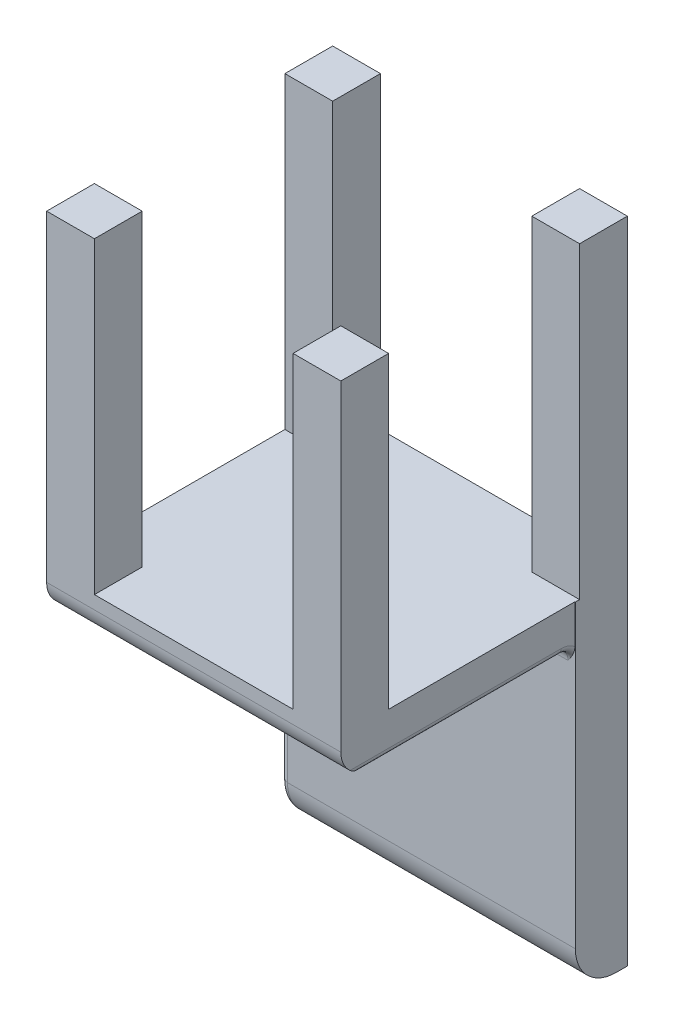
from build123d import *

# Parameters (mm, degrees)
BASE_EXTRUDE_DEPTH  = 76.2
BOSS_EXTRUDE2_DEPTH = 59.427356
SKETCH4_W           = 70
SKETCH4_H           = 70
BOSS_EXTRUDE3_DEPTH = 451.60000000000053
FILLET1_START       = -36.936387435
FILLET1_DEPTH       = 431.8
FILLET1_2_OUTLINE_W = 451.6
FILLET1_2_OUTLINE_H = 70
FILLET1_2_DEPTH     = 70
FILLET1_START_2     = 324.863612565
FILLET1_3_OUTLINE_W = 451.6
FILLET1_3_OUTLINE_H = 70
FILLET1_3_DEPTH     = 70
FILLET2_R           = 19.999999999999996
FILLET4_R           = 9.999999999999996
FILLET7_R           = 9.999999999999996
FILLET11_R          = 40


with BuildPart() as part:
    # Sketch1 → Base-Extrude (new body)
    with BuildSketch(Plane.XY):
        Polygon((-36.93638743455497, 59.4273560209424), (394.863612565445, 59.4273560209424), (394.86361256544507, -440.5726439790576), (-36.93638743455492, -440.5726439790576), align=None)
    extrude(amount=-BASE_EXTRUDE_DEPTH)

    # Sketch3 → Boss-Extrude2 (add)
    with BuildSketch(Plane(origin=(0, 0, 0), x_dir=(1, 0, 0), z_dir=(0, 1, 0))):
        Polygon((-36.93638743455497, 76.2), (394.1216881668196, 76.2), (394.12168816681964, -342.9), (-36.93638743455493, -342.9), align=None)
    extrude(amount=BOSS_EXTRUDE2_DEPTH)

    # Sketch4 → Boss-Extrude3 (add)
    with BuildSketch(Plane(origin=(0, 59.4273560209424, 0), x_dir=(-1, 0, 0), z_dir=(0, 1, 0))):
        Polygon((36.93638743455493, 342.9), (-33.06361256544507, 342.9), (-33.06361256544506, 272.9), (36.93638743455494, 272.9), align=None)
        with Locations((-359.12168816681964, 307.9)):
            Rectangle(SKETCH4_W, SKETCH4_H)
    extrude(amount=BOSS_EXTRUDE3_DEPTH)

    # Fillet1: read off the stored shape, not the designer's step
    # Fillet1 outline → Fillet1 (cut)
    with BuildSketch(Plane.YZ.offset(FILLET1_START)):
        with BuildLine():
            Line((-440.572643979, 0), (-440.572643979, -60))
            ThreePointArc((-440.572643979, -60), (-422.99905085, -17.573593129), (-380.572643979, 0))
            Line((-380.572643979, 0), (-440.572643979, 0))
        make_face()
    extrude(amount=FILLET1_DEPTH, mode=Mode.SUBTRACT)

    # Fillet1 2 outline → Fillet1 2 (add)
    with BuildSketch(Plane.YZ.offset(FILLET1_START)):
        with Locations((285.227356021, -41.2)):
            Rectangle(FILLET1_2_OUTLINE_W, FILLET1_2_OUTLINE_H)
    extrude(amount=FILLET1_2_DEPTH)

    # Fillet1 3 outline → Fillet1 3 (add)
    with BuildSketch(Plane.YZ.offset(FILLET1_START_2)):
        with Locations((285.227356021, -41.2)):
            Rectangle(FILLET1_3_OUTLINE_W, FILLET1_3_OUTLINE_H)
    extrude(amount=FILLET1_3_DEPTH)

    # Fillet2
    fillet2_edges = [part.edges().sort_by_distance(p)[0] for p in [
        (178.59265036613232, 0, 0),
    ]]
    fillet(fillet2_edges, radius=FILLET2_R)

    # Fillet4
    fillet4_edges = [part.edges().sort_by_distance(p)[0] for p in [
        (394.12168816681964, 0, 181.45),
        (394.1216881668196, -5.857864376269045, 5.857864376269044),
    ]]
    fillet(fillet4_edges, radius=FILLET4_R)

    # Fillet7
    fillet7_edges = [part.edges().sort_by_distance(p)[0] for p in [
        (-36.93638743455492, -440.5726439790576, -68.1),
        (-36.936387435, -422.99905085, -17.573593129000002),
        (-36.936387434554945, -200.2863219895, 0),
        (-36.936387434554945, 0, 181.45),
        (-36.936387434554945, -5.857864376269045, 5.857864376269044),
    ]]
    fillet(fillet7_edges, radius=FILLET7_R)

    # Fillet11
    # the kernel refuses this fillet: 40 mm, written as the material it takes off along each edge
    with BuildSketch(Plane(origin=(484.12168816681964, 0, 342.9), x_dir=(0, 0, -1), z_dir=(-1, 0, 0))) as fillet11_piece_1:
        with BuildLine():
            CenterArc((FILLET11_R, -FILLET11_R), FILLET11_R, 90, 90)
            Line((0, -FILLET11_R), (0, 0))
            Line((0, 0), (FILLET11_R, 0))
        make_face()
    extrude(amount=611.0580756013748, mode=Mode.SUBTRACT)


solid = part.part
